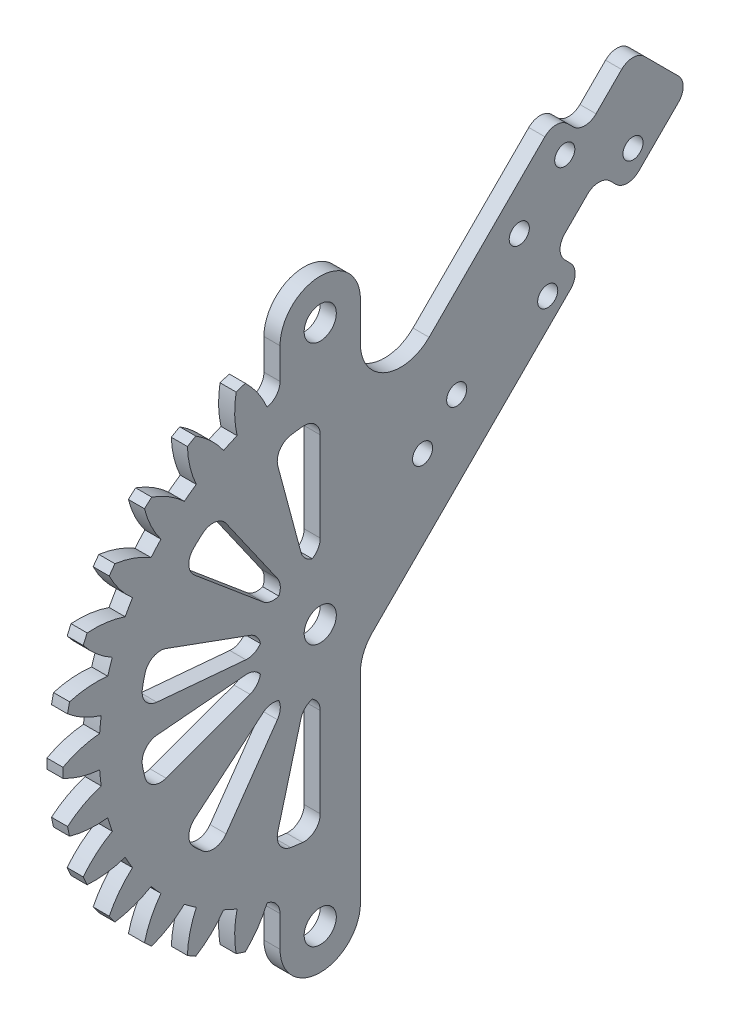
from build123d import *

# Parameters (mm, degrees)
BASPROSKE_W          = 2
BASPROSKE_H          = 32
TOOTHCUT_DEPTH       = 46.299006612
TEETHCUTS_COUNT      = 30
TEETHCUTS_ANGLE      = 348
BORSKE_R             = 0.4
BORE_DEPTH           = 50.0000508
CUT_EXTRUDE_1_DEPTH  = 10
CUT_EXTRUDE_3_DEPTH  = 46.215730311
SKETCH_4_W           = 5
SKETCH_4_H           = 54.998
EXTRUDE_1_DEPTH      = 2
SKETCH_5_R           = 2
CUT_EXTRUDE_4_DEPTH  = 10
EXTRUDE_START        = -2
EXTRUDE_2_DEPTH      = 2
SKETCH_8_R           = 2
CUT_EXTRUDE_6_DEPTH  = 2
FILLET_2_R           = 2
SKETCH_9_R           = 1.25
EXTRUDE_3_DEPTH      = 2
FILLET_3_R           = 5
CUT_EXTRUDE_7_DEPTH  = 10
FILLET_5_R           = 2
SKETCH_13_R          = 1.25
CUT_EXTRUDE_10_DEPTH = 10
CUT_EXTRUDE_11_DEPTH = 10
CUT_EXTRUDE_12_DEPTH = 2
FILLET_7_R           = 2
SKETCH_16_R          = 1.25
CUT_EXTRUDE_13_DEPTH = 2


with BuildPart() as part:
    # BasProSke → Base-Revolve (revolve)
    with BuildSketch(Plane(origin=(0, 0, 0), x_dir=(1, 0, 0), z_dir=(0, 1, 0)), mode=Mode.PRIVATE) as base_revolve_sk:
        with Locations((1, 16)):
            Rectangle(BASPROSKE_W, BASPROSKE_H)
    revolve(base_revolve_sk.sketch.rotate(Axis((-10, 0, 0), (1, 0, 0)), 180), axis=Axis((-10, 0, 0), (1, 0, 0)))

    # TooCutSke → ToothCut (cut, through all)
    with BuildSketch(Plane(origin=(0, 0, 0), x_dir=(0, 0, -1), z_dir=(1, 0, 0))):
        with BuildLine():
            ThreePointArc((0.918551563, 27.483654488), (0, 27.499), (-0.918551563, 27.483654488))
            ThreePointArc((-0.918551563, 27.483654488), (-1.617208176, 29.787801627), (-2.761784709, 31.906093311))
            ThreePointArc((-2.761784709, 31.906093311), (0, 32.0254), (2.761784709, 31.906093311))
            ThreePointArc((2.761784709, 31.906093311), (1.617208176, 29.787801627), (0.918551563, 27.483654488))
        make_face()
    toothcut = extrude(amount=TOOTHCUT_DEPTH, mode=Mode.SUBTRACT)

    # TeethCuts: ToothCut ×30 about axis
    teethcuts_axis = Axis((-10, 0, 0), (1, 0, 0))
    for i in range(1, TEETHCUTS_COUNT):
        add(toothcut.rotate(teethcuts_axis, i * TEETHCUTS_ANGLE / (TEETHCUTS_COUNT - 1)), mode=Mode.SUBTRACT)

    # BorSke → Bore (cut, symmetric)
    with BuildSketch(Plane(origin=(0, 0, 0), x_dir=(0, 0, -1), z_dir=(1, 0, 0))):
        with Locations(Location((0, 0, 0), (0, 0, 180))):
            Circle(BORSKE_R)
    extrude(amount=BORE_DEPTH, both=True, mode=Mode.SUBTRACT)

    # 草图1 → 切除-拉伸1 (cut)
    with BuildSketch(Plane(origin=(2, 0, 0), x_dir=(0, 0, -1), z_dir=(1, 0, 0))):
        Polygon((0, 36.709692548), (0, -36.235976991), (49.798394173, -32.898593417), (48.368086927, 29.830595794), align=None)
    extrude(amount=-CUT_EXTRUDE_1_DEPTH, mode=Mode.SUBTRACT)

    # 草图2 → 切除-拉伸3 (cut, through all)
    with BuildSketch(Plane(origin=(2, 0, 0), x_dir=(0, 0, -1), z_dir=(1, 0, 0))):
        with BuildLine():
            Line((-5.550793745, 26.932948034), (-6.873263305, 33.349688695))
            Line((-6.873263305, 33.349688695), (-0.638197527, 34.2357484))
            Line((-0.638197527, 34.2357484), (0, 27.499))
            ThreePointArc((0, 27.499), (-2.789790585, 27.357121002), (-5.550793745, 26.932948034))
        make_face()
        with BuildLine():
            Line((-5.724236671, -26.896619035), (-4.396676617, -32.833153486))
            Line((-4.396676617, -32.833153486), (-0.063712698, -31.064954068))
            Line((-0.063712698, -31.064954068), (0, -27.499))
            ThreePointArc((0, -27.499), (-2.877922354, -27.347990126), (-5.724236671, -26.896619035))
        make_face()
    extrude(amount=-CUT_EXTRUDE_3_DEPTH, mode=Mode.SUBTRACT)

    # 草图4 → 凸台-拉伸1 (add)
    with BuildSketch(Plane(origin=(2, 0, 0), x_dir=(0, 0, -1), z_dir=(1, 0, 0))):
        with Locations((2.5, 0)):
            Rectangle(SKETCH_4_W, SKETCH_4_H)
    extrude(amount=-EXTRUDE_1_DEPTH)

    # 草图5 → 切除-拉伸4 (cut)
    with BuildSketch(Plane(origin=(2, 0, 0), x_dir=(0, 0, -1), z_dir=(1, 0, 0))):
        Circle(SKETCH_5_R)
    extrude(amount=-CUT_EXTRUDE_4_DEPTH, mode=Mode.SUBTRACT)

    # 草图6 → 凸台-拉伸2 (add)
    with BuildSketch(Plane(origin=(2, 0, 0), x_dir=(0, 0, -1), z_dir=(1, 0, 0)).offset(EXTRUDE_START)):
        with BuildLine():
            Line((5, 27.499), (5, 32.499))
            ThreePointArc((5, 32.499), (0, 37.499), (-5, 32.499))
            Line((-5, 32.499), (-5, 27.040617615))
            ThreePointArc((-5, 27.040617615), (-2.510483739, 27.384164628), (0, 27.499))
            Line((0, 27.499), (5, 27.499))
        make_face()
    extrude_2 = extrude(amount=EXTRUDE_2_DEPTH)

    # 草图8 → 切除-拉伸6 (cut)
    with BuildSketch(Plane(origin=(2, 0, 0), x_dir=(0, 0, -1), z_dir=(1, 0, 0))):
        with Locations((0, 32.5)):
            Circle(SKETCH_8_R)
    cut_extrude_6 = extrude(amount=-CUT_EXTRUDE_6_DEPTH, mode=Mode.SUBTRACT)

    # 镜向2: 凸台-拉伸2, 切除-拉伸6 across plane
    add(extrude_2.mirror(Plane.ZX))
    add(cut_extrude_6.mirror(Plane.ZX), mode=Mode.SUBTRACT)

    # 圆角2
    fillet_2_edges = [part.edges().sort_by_distance(p)[0] for p in [
        (1, 27.040617615, 5),
        (1, -27.040617615, 5),
    ]]
    fillet(fillet_2_edges, radius=FILLET_2_R)

    # 草图9 → 凸台-拉伸3 (add)
    with BuildSketch(Plane(origin=(2, 0, 0), x_dir=(0, 0, -1), z_dir=(1, 0, 0))):
        Polygon((5, 15.606601718), (35.355339059, 45.961940777), (45.961940777, 35.355339059), (5, -5.606601718), align=None)
        with Locations((12.727922061, 12.02081528)):
            Circle(SKETCH_9_R, mode=Mode.SUBTRACT)
        with Locations((16.970562748, 16.263455967)):
            Circle(SKETCH_9_R, mode=Mode.SUBTRACT)
    extrude(amount=-EXTRUDE_3_DEPTH)

    # 圆角3
    fillet_3_edges = [part.edges().sort_by_distance(p)[0] for p in [
        (1, -5.606601718, -5),
        (1, 15.606601718, -5),
    ]]
    fillet(fillet_3_edges, radius=FILLET_3_R)

    # 草图10 → 切除-拉伸7 (cut)
    with BuildSketch(Plane(origin=(2, 0, 0), x_dir=(0, 0, -1), z_dir=(1, 0, 0))):
        with BuildLine():
            Line((0, -7.5), (0, -22.5))
            ThreePointArc((0, -22.5), (-2.936839325, -22.307509381), (-5.823428515, -21.733331092))
            Line((-5.823428515, -21.733331092), (-1.941142838, -7.244443697))
            ThreePointArc((-1.941142838, -7.244443697), (-0.978946442, -7.43583646), (0, -7.5))
        make_face()
        with BuildLine():
            Line((-4.301823273, -6.143640332), (-12.905469818, -18.430920997))
            ThreePointArc((-12.905469818, -18.430920997), (-15.200779671, -16.588740078), (-17.23599997, -14.462721218))
            Line((-17.23599997, -14.462721218), (-5.745333323, -4.820907073))
            ThreePointArc((-5.745333323, -4.820907073), (-5.066926557, -5.529580026), (-4.301823273, -6.143640332))
        make_face()
        with BuildLine():
            Line((-7.047694656, -2.565151075), (-21.143083968, -7.695453225))
            ThreePointArc((-21.143083968, -7.695453225), (-21.96666016, -4.869891314), (-22.414380707, -1.961004212))
            Line((-22.414380707, -1.961004212), (-7.471460236, -0.653668071))
            ThreePointArc((-7.471460236, -0.653668071), (-7.322220053, -1.623297105), (-7.047694656, -2.565151075))
        make_face()
        with BuildLine():
            Line((-7.471460236, 0.653668071), (-22.414380707, 1.961004212))
            ThreePointArc((-22.414380707, 1.961004212), (-21.96666016, 4.869891314), (-21.143083968, 7.695453225))
            Line((-21.143083968, 7.695453225), (-7.047694656, 2.565151075))
            ThreePointArc((-7.047694656, 2.565151075), (-7.322220053, 1.623297105), (-7.471460236, 0.653668071))
        make_face()
        with BuildLine():
            Line((-5.745333323, 4.820907073), (-17.23599997, 14.462721218))
            ThreePointArc((-17.23599997, 14.462721218), (-15.200779671, 16.588740078), (-12.905469818, 18.430920997))
            Line((-12.905469818, 18.430920997), (-4.301823273, 6.143640332))
            ThreePointArc((-4.301823273, 6.143640332), (-5.066926557, 5.529580026), (-5.745333323, 4.820907073))
        make_face()
        with BuildLine():
            Line((-1.941142838, 7.244443697), (-5.823428515, 21.733331092))
            ThreePointArc((-5.823428515, 21.733331092), (-2.936839325, 22.307509381), (0, 22.5))
            Line((0, 22.5), (0, 7.5))
            ThreePointArc((0, 7.5), (-0.978946442, 7.43583646), (-1.941142838, 7.244443697))
        make_face()
    extrude(amount=-CUT_EXTRUDE_7_DEPTH, mode=Mode.SUBTRACT)

    # 圆角5
    # the kernel refuses this fillet: 2 mm, written as the material it adds along each edge
    with BuildSketch(Plane(origin=(2, -7.695453225, 21.143083968), x_dir=(0, 0.34202014332566605, -0.9396926207859093), z_dir=(-1, 0, 0)), Plane(origin=(2, 14.462721218, 17.23599997), x_dir=(0, -0.6427876096865374, -0.7660444431189796), z_dir=(-1, 0, 0)), Plane(origin=(2, -18.430920997, 12.905469818), x_dir=(0, 0.8191520442889908, -0.5735764363510474), z_dir=(-1, 0, 0)), Plane(origin=(2, -22.5, 0), x_dir=(0, 1, 0), z_dir=(-1, 0, 0)), Plane(origin=(2, 21.733331092, 5.823428515), x_dir=(0, -0.9659258262890684, -0.2588190451025201), z_dir=(-1, 0, 0)), Plane(origin=(2, 1.961004212, 22.414380707), x_dir=(0, -0.08715574274765509, -0.9961946980917459), z_dir=(-1, 0, 0))) as fillet_5_piece_1:
        with BuildLine():
            CenterArc((2.097794237, -2), FILLET_5_R, 90, 95.598737816)
            ThreePointArc((0.107335138, -2.195121951), (0.026849805, -1.098872287), (0, 0))
            Line((0, 0), (2.097794237, 0))
        make_face()
    extrude(amount=2)
    with BuildSketch(Plane(origin=(2, -1.961004212, 22.414380707), x_dir=(0, -0.9907493352683342, -0.13570465970391027), z_dir=(-1, 0, 0)), Plane(origin=(2, -21.733331092, 5.823428515), x_dir=(0, -0.21133556231825887, -0.9774135665620901), z_dir=(-1, 0, 0)), Plane(origin=(2, 22.5, 0), x_dir=(0, -0.048838768311321716, 0.998806675343048), z_dir=(-1, 0, 0)), Plane(origin=(2, 7.695453225, 21.143083968), x_dir=(0, -0.9552751049492573, 0.29571857206503877), z_dir=(-1, 0, 0))) as fillet_5_piece_2:
        with BuildLine():
            CenterArc((2.100067037, -1.997613351), FILLET_5_R, 87.200631092, 95.598737816)
            Line((0.102453687, -2.095290887), (0, 0))
            ThreePointArc((0, 0), (1.098872287, 0.026849805), (2.197744574, 0))
        make_face()
    extrude(amount=2)
    with BuildSketch(Plane(origin=(2, 6.143640332, 4.301823273), x_dir=(0, 0.8191520442889909, 0.5735764363510474), z_dir=(-1, 0, 0)), Plane(origin=(2, -4.820907073, 5.745333323), x_dir=(0, -0.6427876096865379, 0.7660444431189791), z_dir=(-1, 0, 0))) as fillet_5_piece_3:
        with BuildLine():
            CenterArc((1.787087811, -2), FILLET_5_R, 90, 77.846802531)
            ThreePointArc((-0.168088571, -1.578947368), (-0.042140531, -0.793934594), (0, 0))
            Line((0, 0), (1.787087811, 0))
        make_face()
    extrude(amount=2)
    with BuildSketch(Plane(origin=(2, 4.820907073, 5.745333323), x_dir=(0, 0.693696064498077, -0.7202678460821916), z_dir=(-1, 0, 0)), Plane(origin=(2, -6.143640332, 4.301823273), x_dir=(0, 0.6570674137305856, 0.7538318206426414), z_dir=(-1, 0, 0)), Plane(origin=(2, -7.5, 0), x_dir=(0, 0.10585794590086074, 0.9943812625395002), z_dir=(-1, 0, 0)), Plane(origin=(2, 7.244443697, 1.941142838), x_dir=(0, 0.15511388497475953, -0.9878965951394089), z_dir=(-1, 0, 0)), Plane(origin=(2, 0.653668071, 7.471460236), x_dir=(0, 0.9813712137228954, -0.19212116196830356), z_dir=(-1, 0, 0)), Plane(origin=(2, -2.565151075, 7.047694656), x_dir=(0, 0.9706182844853181, 0.24062449131952102), z_dir=(-1, 0, 0))) as fillet_5_piece_4:
        with BuildLine():
            CenterArc((1.79958508, -1.988762525), FILLET_5_R, 96.076598735, 77.846802531)
            Line((-0.189177445, -1.777046633), (0, 0))
            ThreePointArc((0, 0), (0.793934594, -0.042140531), (1.587869189, 0))
        make_face()
    extrude(amount=2)
    with BuildSketch(Plane(origin=(2, 18.430920997, 12.905469818), x_dir=(0, -0.8191520442889908, -0.5735764363510474), z_dir=(-1, 0, 0)), Plane(origin=(2, -14.462721218, 17.23599997), x_dir=(0, 0.642787609686537, -0.7660444431189801), z_dir=(-1, 0, 0))) as fillet_5_piece_5:
        with BuildLine():
            CenterArc((2.097794237, 2), FILLET_5_R, 174.401262184, 95.598737816)
            ThreePointArc((0.107335138, 2.195121951), (0.026849805, 1.098872287), (0, 0))
            Line((0, 0), (2.097794237, 0))
        make_face()
    extrude(amount=2)
    with BuildSketch(Plane(origin=(2, -7.244443697, 1.941142838), x_dir=(0, -0.15511388497475886, -0.9878965951394089), z_dir=(-1, 0, 0)), Plane(origin=(2, 7.5, 0), x_dir=(0, -0.10585794590086078, 0.9943812625395002), z_dir=(-1, 0, 0)), Plane(origin=(2, 2.565151075, 7.047694656), x_dir=(0, -0.9706182844853178, 0.24062449131952202), z_dir=(-1, 0, 0)), Plane(origin=(2, -0.653668071, 7.471460236), x_dir=(0, -0.9813712137228956, -0.1921211619683025), z_dir=(-1, 0, 0))) as fillet_5_piece_6:
        with BuildLine():
            CenterArc((1.79958508, 1.988762525), FILLET_5_R, 186.076598735, 77.846802531)
            Line((-0.189177445, 1.777046633), (0, 0))
            ThreePointArc((0, 0), (0.793934594, 0.042140531), (1.587869189, 0))
        make_face()
    extrude(amount=2)

    # 草图13 → 切除-拉伸10 (cut)
    with BuildSketch(Plane(origin=(2, 0, 0), x_dir=(0, 0, -1), z_dir=(1, 0, 0))):
        with Locations((38.890872965, 31.819805153)):
            Circle(SKETCH_13_R)
        with Locations((28.284271247, 21.213203436)):
            Circle(SKETCH_13_R)
    extrude(amount=-CUT_EXTRUDE_10_DEPTH, mode=Mode.SUBTRACT)

    # 草图14 → 切除-拉伸11 (cut)
    with BuildSketch(Plane(origin=(2, 0, 0), x_dir=(0, 0, -1), z_dir=(1, 0, 0))):
        Polygon((32.526911935, 21.920310217), (38.183766184, 27.577164466), (34.648232278, 31.112698372), (28.991378029, 25.455844123), align=None)
    extrude(amount=-CUT_EXTRUDE_11_DEPTH, mode=Mode.SUBTRACT)

    # 草图12 → 切除-拉伸12 (cut)
    with BuildSketch(Plane(origin=(2, 0, 0), x_dir=(0, 0, -1), z_dir=(1, 0, 0))):
        Polygon((35.355339059, 45.961940777), (38.890872965, 42.426406871), (32.880465325, 36.415999231), (29.344931419, 39.951533137), align=None)
    extrude(amount=-CUT_EXTRUDE_12_DEPTH, mode=Mode.SUBTRACT)

    # 圆角7
    fillet_7_edges = [part.edges().sort_by_distance(p)[0] for p in [
        (1, 27.577164466, -38.183766184),
        (1, 21.920310217, -32.526911935),
        (1, 25.455844123, -28.991378029),
        (1, 31.112698372, -34.648232278),
        (1, 39.951533137, -29.344931419),
        (1, 42.426406871, -38.890872965),
        (1, 36.415999231, -32.880465325),
        (1, 35.355339059, -45.961940777),
    ]]
    fillet(fillet_7_edges, radius=FILLET_7_R)

    # 草图16 → 切除-拉伸13 (cut)
    with BuildSketch(Plane(origin=(2, 0, 0), x_dir=(0, 0, -1), z_dir=(1, 0, 0))):
        with Locations((30.405591591, 35.355339059)):
            Circle(SKETCH_16_R)
        with Locations((24.748737342, 29.69848481)):
            Circle(SKETCH_16_R)
    extrude(amount=-CUT_EXTRUDE_13_DEPTH, mode=Mode.SUBTRACT)


solid = part.part
